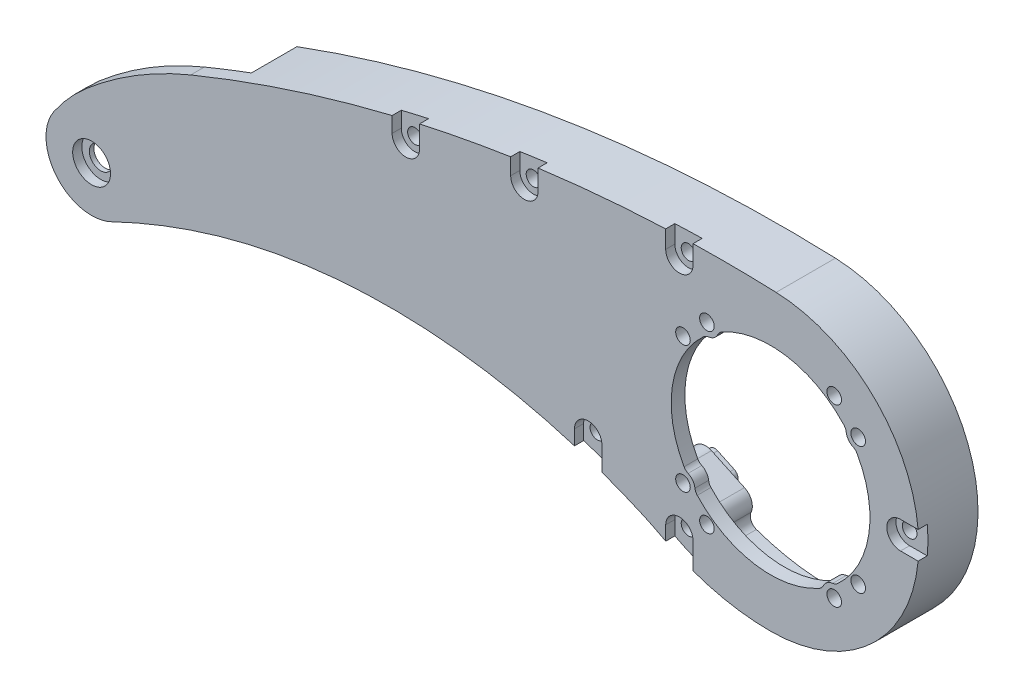
from build123d import *

# Parameters (mm, degrees)
SKETCH_1_R          = 1.6
EXTRUDE_1_DEPTH     = 3
EXTRUDE_START       = 10
SKETCH_2_R          = 1.6
EXTRUDE_2_DEPTH     = 10
EXTRUDE_3_DEPTH     = 2
CUT_EXTRUDE_1_REACH = 164.764
SKETCH_5_R          = 1.6
CUT_EXTRUDE_4_REACH = 164.687
SKETCH_10_R         = 2.5
SKETCH_11_R         = 4.15
CUT_EXTRUDE_5_DEPTH = 2
CUT_EXTRUDE_START   = -2
SKETCH_13_R         = 1.6
CUT_EXTRUDE_6_DEPTH = 2
EXTRUDE_START_2     = 1.5
SKETCH_14_R         = 10
SKETCH_14_R_2       = 7
EXTRUDE_4_DEPTH     = 1.5


with BuildPart() as part:
    # 草图1 → 凸台-拉伸1 (new body)
    with BuildSketch(Plane.XY):
        with BuildLine():
            ThreePointArc((-23.6380873, -26.566491362), (-12.185705724, -30.993964901), (0, -32.5))
            ThreePointArc((0, -32.5), (32.494299771, -0.608672659), (1.217131806, 32.477201083))
            ThreePointArc((1.217131806, 32.477201083), (-64.206902417, 27.922113621), (-127.172269011, 9.580475598))
            ThreePointArc((-127.172269011, 9.580475598), (-139.222290641, 3.45440527), (-150.14384136, -4.511239012))
            ThreePointArc((-150.14384136, -4.511239012), (-153.910924638, -8.201852374), (-157.1671235, -12.350190882))
            ThreePointArc((-157.1671235, -12.350190882), (-156.816374649, -24.130693578), (-145.491863518, -27.395462511))
            ThreePointArc((-145.491863518, -27.395462511), (-145.026167645, -27.212412967), (-144.570211335, -27.006297405))
            ThreePointArc((-144.570211335, -27.006297405), (-136.08176084, -23.223756861), (-127.379272112, -19.963680984))
            ThreePointArc((-127.379272112, -19.963680984), (-77.471346593, -12.811545944), (-28.370763381, -24.26086005))
            ThreePointArc((-28.370763381, -24.26086005), (-25.98221149, -25.368078233), (-23.6380873, -26.566491362))
        make_face()
        with BuildLine():
            ThreePointArc((18.083792076, 11.563072091), (18.591300533, 11.22000242), (18.971162667, 10.73941279))
            ThreePointArc((18.971162667, 10.73941279), (21.531605825, -3.410271338), (14.723986814, -16.076200182))
            ThreePointArc((14.723986814, -16.076200182), (14.214206094, -16.415884227), (13.62552251, -16.585334135))
            ThreePointArc((13.62552251, -16.585334135), (12.402268823, -17.070258581), (11.563072091, -18.083792076))
            ThreePointArc((11.563072091, -18.083792076), (11.22000242, -18.591300533), (10.73941279, -18.971162667))
            ThreePointArc((10.73941279, -18.971162667), (-3.410271338, -21.531605825), (-16.076200182, -14.723986814))
            ThreePointArc((-16.076200182, -14.723986814), (-16.415884227, -14.214206094), (-16.585334135, -13.62552251))
            ThreePointArc((-16.585334135, -13.62552251), (-17.070258581, -12.402268823), (-18.083792076, -11.563072091))
            ThreePointArc((-18.083792076, -11.563072091), (-18.591300533, -11.22000242), (-18.971162667, -10.73941279))
            ThreePointArc((-18.971162667, -10.73941279), (-21.531605825, 3.410271338), (-14.723986814, 16.076200182))
            ThreePointArc((-14.723986814, 16.076200182), (-14.214206094, 16.415884227), (-13.62552251, 16.585334135))
            ThreePointArc((-13.62552251, 16.585334135), (-12.402268823, 17.070258581), (-11.563072091, 18.083792076))
            ThreePointArc((-11.563072091, 18.083792076), (-11.22000242, 18.591300533), (-10.73941279, 18.971162667))
            ThreePointArc((-10.73941279, 18.971162667), (3.410271338, 21.531605825), (16.076200182, 14.723986814))
            ThreePointArc((16.076200182, 14.723986814), (16.415884227, 14.214206094), (16.585334135, 13.62552251))
            ThreePointArc((16.585334135, 13.62552251), (17.070258581, 12.402268823), (18.083792076, 11.563072091))
        make_face(mode=Mode.SUBTRACT)
        with Locations((-13.959899742, -19.214153616)):
            Circle(SKETCH_1_R, mode=Mode.SUBTRACT)
        with Locations((13.959899742, -19.214153616)):
            Circle(SKETCH_1_R, mode=Mode.SUBTRACT)
        with Locations((-19.214153616, -13.959899742)):
            Circle(SKETCH_1_R, mode=Mode.SUBTRACT)
        with Locations((19.214153616, -13.959899742)):
            Circle(SKETCH_1_R, mode=Mode.SUBTRACT)
        with Locations((-19.214153616, 13.959899742)):
            Circle(SKETCH_1_R, mode=Mode.SUBTRACT)
        with Locations((19.214153616, 13.959899742)):
            Circle(SKETCH_1_R, mode=Mode.SUBTRACT)
        with Locations((-13.959899742, 19.214153616)):
            Circle(SKETCH_1_R, mode=Mode.SUBTRACT)
        with Locations((13.959899742, 19.214153616)):
            Circle(SKETCH_1_R, mode=Mode.SUBTRACT)
    extrude(amount=EXTRUDE_1_DEPTH)

    # 草图2 → 凸台-拉伸2 (add)
    with BuildSketch(Plane(origin=(0, 0, 0), x_dir=(-1, 0, 0), z_dir=(0, 0, -1)).offset(EXTRUDE_START)):
        with BuildLine():
            ThreePointArc((17.001102074, 28.618241459), (17.803337861, 26.493729725), (19.86429336, 25.540002931))
            Line((19.86429336, 25.540002931), (27.856104149, 25.178118556))
            ThreePointArc((27.856104149, 25.178118556), (29.994821549, 25.941676183), (30.985784325, 27.98498848))
            ThreePointArc((30.985784325, 27.98498848), (31.663067744, 29.355553639), (33.113908291, 29.837449265))
            ThreePointArc((33.113908291, 29.837449265), (41.227314196, 29.119699609), (49.318671562, 28.185646114))
            ThreePointArc((49.318671562, 28.185646114), (50.642440563, 27.420925697), (51.029255455, 25.941893607))
            ThreePointArc((51.029255455, 25.941893607), (51.587558118, 23.740659748), (53.528225459, 22.561277437))
            Line((53.528225459, 22.561277437), (61.428685658, 21.303211995))
            ThreePointArc((61.428685658, 21.303211995), (63.63968675, 21.821484643), (64.854085448, 23.740434399))
            ThreePointArc((64.854085448, 23.740434399), (65.681160173, 25.026167296), (67.176979656, 25.341897814))
            ThreePointArc((67.176979656, 25.341897814), (71.378861197, 24.513870134), (75.568707204, 23.626949189))
            ThreePointArc((75.568707204, 23.626949189), (76.820720374, 22.749666619), (77.077039123, 21.242529471))
            ThreePointArc((77.077039123, 21.242529471), (77.441191522, 19.000984157), (79.271578812, 17.656806068))
            Line((79.271578812, 17.656806068), (87.032175615, 15.714349565))
            ThreePointArc((87.032175615, 15.714349565), (89.279958958, 16.037772516), (90.657125441, 17.843470399))
            ThreePointArc((90.657125441, 17.843470399), (91.593206584, 19.052153062), (93.11086617, 19.236193992))
            ThreePointArc((93.11086617, 19.236193992), (103.776807204, 16.016684998), (114.31810295, 12.409938501))
            ThreePointArc((114.31810295, 12.409938501), (115.844352177, 12.477074745), (116.877933734, 13.602087253))
            ThreePointArc((116.877933734, 13.602087253), (58.758007498, 28.843357745), (-1.217131806, 32.477201083))
            ThreePointArc((-1.217131806, 32.477201083), (-32.494299771, -0.608672659), (0, -32.5))
            ThreePointArc((0, -32.5), (12.185705724, -30.993964901), (23.6380873, -26.566491362))
            ThreePointArc((23.6380873, -26.566491362), (25.98221149, -25.368078233), (28.370763381, -24.26086005))
            ThreePointArc((28.370763381, -24.26086005), (42.41745626, -18.97671256), (56.959270146, -15.266261857))
            ThreePointArc((56.959270146, -15.266261857), (56.095337342, -13.994443781), (54.584087249, -13.71155818))
            ThreePointArc((54.584087249, -13.71155818), (53.795279647, -13.881664917), (53.007476337, -14.056363738))
            ThreePointArc((53.007476337, -14.056363738), (51.49343256, -13.803829953), (50.585765393, -12.565992248))
            ThreePointArc((50.585765393, -12.565992248), (49.16571342, -10.693278587), (46.831558377, -10.418825857))
            Line((46.831558377, -10.418825857), (39.155257944, -12.671471339))
            ThreePointArc((39.155257944, -12.671471339), (37.339549641, -14.163720453), (37.156649606, -16.506827715))
            ThreePointArc((37.156649606, -16.506827715), (37.061812001, -18.038855032), (35.924321082, -19.069493805))
            ThreePointArc((35.924321082, -19.069493805), (34.270222566, -19.684778141), (32.624096936, -20.321085557))
            ThreePointArc((32.624096936, -20.321085557), (31.089233, -20.303922581), (30.002334443, -19.220062167))
            ThreePointArc((30.002334443, -19.220062167), (28.311680005, -17.587490076), (25.963057786, -17.674540277))
            Line((25.963057786, -17.674540277), (18.723451368, -21.078669963))
            ThreePointArc((18.723451368, -21.078669963), (17.187310183, -22.750078076), (17.261694817, -25.018954835))
            ThreePointArc((17.261694817, -25.018954835), (17.275070203, -26.622295223), (16.106540278, -27.720210117))
            ThreePointArc((16.106540278, -27.720210117), (8.172329404, -29.799953184), (0, -30.5))
            ThreePointArc((0, -30.5), (-19.662506126, -23.315999932), (-30.062360099, -5.148252645))
            ThreePointArc((-30.062360099, -5.148252645), (-29.685338806, -3.685938076), (-28.342105263, -2.995841994))
            ThreePointArc((-28.342105263, -2.995841994), (-25.5, 0), (-28.342105263, 2.995841994))
            ThreePointArc((-28.342105263, 2.995841994), (-29.685338806, 3.685938076), (-30.062360099, 5.148252645))
            ThreePointArc((-30.062360099, 5.148252645), (-20.095728615, 22.943663427), (-1.142231387, 30.478604093))
            ThreePointArc((-1.142231387, 30.478604093), (6.952265997, 30.674453283), (15.049110071, 30.655457646))
            ThreePointArc((15.049110071, 30.655457646), (16.450460044, 30.044409415), (17.001102074, 28.618241459))
        make_face()
        with Locations((20, -23.793522369)):
            Circle(SKETCH_2_R, mode=Mode.SUBTRACT)
        with Locations((-28.5, 0)):
            Circle(SKETCH_2_R, mode=Mode.SUBTRACT)
        with Locations((40, -15.550084001)):
            Circle(SKETCH_2_R, mode=Mode.SUBTRACT)
        with Locations((20, 28.536931977)):
            Circle(SKETCH_2_R, mode=Mode.SUBTRACT)
        with Locations((54, 25.523950011)):
            Circle(SKETCH_2_R, mode=Mode.SUBTRACT)
        with Locations((80, 20.567029869)):
            Circle(SKETCH_2_R, mode=Mode.SUBTRACT)
    extrude(amount=-EXTRUDE_2_DEPTH)

    # 草图4 → 凸台-拉伸3 (add)
    with BuildSketch(Plane(origin=(0, 0, -10), x_dir=(-1, 0, 0), z_dir=(0, 0, -1))):
        with BuildLine():
            Line((27.877880734, -21.746818887), (24.258077525, -23.44888373))
            ThreePointArc((24.258077525, -23.44888373), (22.262377006, -22.729731843), (22.981528893, -20.734031323))
            Line((22.981528893, -20.734031323), (26.601332102, -19.031966481))
            ThreePointArc((26.601332102, -19.031966481), (28.597032621, -19.751118368), (27.877880734, -21.746818887))
        make_face()
        with BuildLine():
            Line((27.92395747, 26.67658308), (23.928052075, 26.857525267))
            ThreePointArc((23.928052075, 26.857525267), (22.497440872, 28.42384311), (24.063758715, 29.854454313))
            Line((24.063758715, 29.854454313), (28.05966411, 29.673512126))
            ThreePointArc((28.05966411, 29.673512126), (29.490275313, 28.107194282), (27.92395747, 26.67658308))
        make_face()
        with BuildLine():
            Line((87.396386209, 17.169461466), (83.516087807, 18.140689717))
            ThreePointArc((83.516087807, 18.140689717), (82.425186501, 19.960012212), (84.244508996, 21.050913518))
            Line((84.244508996, 21.050913518), (88.124807397, 20.079685267))
            ThreePointArc((88.124807397, 20.079685267), (89.215708703, 18.260362772), (87.396386209, 17.169461466))
        make_face()
        with BuildLine():
            Line((48.098671461, -14.73674485), (44.260521244, -15.863067591))
            ThreePointArc((44.260521244, -15.863067591), (42.398843885, -14.846132288), (43.415779189, -12.984454929))
            Line((43.415779189, -12.984454929), (47.253929405, -11.858132188))
            ThreePointArc((47.253929405, -11.858132188), (49.115606764, -12.875067491), (48.098671461, -14.73674485))
        make_face()
        with BuildLine():
            Line((61.664572928, 22.784548282), (57.714342829, 23.413581003))
            ThreePointArc((57.714342829, 23.413581003), (56.468893812, 25.130804561), (58.186117369, 26.376253578))
            Line((58.186117369, 26.376253578), (62.136347469, 25.747220857))
            ThreePointArc((62.136347469, 25.747220857), (63.381796485, 24.029997299), (61.664572928, 22.784548282))
        make_face()
    extrude(amount=EXTRUDE_3_DEPTH)

    # 草图5 → 切除-拉伸1 (cut, up to next)
    with BuildSketch(Plane(origin=(0, 0, -10), x_dir=(-1, 0, 0), z_dir=(0, 0, -1)), mode=Mode.PRIVATE) as cut_extrude_1_sk1:
        with Locations((-28.5, 0)):
            Circle(SKETCH_5_R)
    cut_extrude_1_tool1 = extrude(cut_extrude_1_sk1.sketch, amount=-CUT_EXTRUDE_1_REACH, mode=Mode.PRIVATE) & part.part
    # 草图5 → 切除-拉伸1 (cut, up to next)
    with BuildSketch(Plane(origin=(0, 0, -10), x_dir=(-1, 0, 0), z_dir=(0, 0, -1)), mode=Mode.PRIVATE) as cut_extrude_1_sk2:
        with Locations((54, 25.523950011)):
            Circle(SKETCH_5_R)
    cut_extrude_1_tool2 = extrude(cut_extrude_1_sk2.sketch, amount=-CUT_EXTRUDE_1_REACH, mode=Mode.PRIVATE) & part.part
    # 草图5 → 切除-拉伸1 (cut, up to next)
    with BuildSketch(Plane(origin=(0, 0, -10), x_dir=(-1, 0, 0), z_dir=(0, 0, -1)), mode=Mode.PRIVATE) as cut_extrude_1_sk3:
        with Locations((80, 20.567029869)):
            Circle(SKETCH_5_R)
    cut_extrude_1_tool3 = extrude(cut_extrude_1_sk3.sketch, amount=-CUT_EXTRUDE_1_REACH, mode=Mode.PRIVATE) & part.part
    # 草图5 → 切除-拉伸1 (cut, up to next)
    with BuildSketch(Plane(origin=(0, 0, -10), x_dir=(-1, 0, 0), z_dir=(0, 0, -1)), mode=Mode.PRIVATE) as cut_extrude_1_sk4:
        with Locations((40, -15.550084001)):
            Circle(SKETCH_5_R)
    cut_extrude_1_tool4 = extrude(cut_extrude_1_sk4.sketch, amount=-CUT_EXTRUDE_1_REACH, mode=Mode.PRIVATE) & part.part
    # 草图5 → 切除-拉伸1 (cut, up to next)
    with BuildSketch(Plane(origin=(0, 0, -10), x_dir=(-1, 0, 0), z_dir=(0, 0, -1)), mode=Mode.PRIVATE) as cut_extrude_1_sk5:
        with Locations((20, -23.793522369)):
            Circle(SKETCH_5_R)
    cut_extrude_1_tool5 = extrude(cut_extrude_1_sk5.sketch, amount=-CUT_EXTRUDE_1_REACH, mode=Mode.PRIVATE) & part.part
    # 草图5 → 切除-拉伸1 (cut, up to next)
    with BuildSketch(Plane(origin=(0, 0, -10), x_dir=(-1, 0, 0), z_dir=(0, 0, -1)), mode=Mode.PRIVATE) as cut_extrude_1_sk6:
        with Locations((20, 28.536931977)):
            Circle(SKETCH_5_R)
    cut_extrude_1_tool6 = extrude(cut_extrude_1_sk6.sketch, amount=-CUT_EXTRUDE_1_REACH, mode=Mode.PRIVATE) & part.part
    add(cut_extrude_1_tool1.solids().sort_by_distance((28.5, 0, -10))[0], mode=Mode.SUBTRACT)
    add(cut_extrude_1_tool2.solids().sort_by_distance((-54, 25.52395, -10))[0], mode=Mode.SUBTRACT)
    add(cut_extrude_1_tool3.solids().sort_by_distance((-80, 20.56703, -10))[0], mode=Mode.SUBTRACT)
    add(cut_extrude_1_tool4.solids().sort_by_distance((-40, -15.550084, -10))[0], mode=Mode.SUBTRACT)
    add(cut_extrude_1_tool5.solids().sort_by_distance((-20, -23.793522, -10))[0], mode=Mode.SUBTRACT)
    add(cut_extrude_1_tool6.solids().sort_by_distance((-20, 28.536932, -10))[0], mode=Mode.SUBTRACT)

    # 草图10 → 切除-拉伸4 (cut, up to next)
    with BuildSketch(Plane(origin=(0, 0, 0), x_dir=(-1, 0, 0), z_dir=(0, 0, -1)), mode=Mode.PRIVATE) as cut_extrude_4_sk1:
        with Locations((148.916083752, -18)):
            Circle(SKETCH_10_R)
    cut_extrude_4_tool1 = extrude(cut_extrude_4_sk1.sketch, amount=-CUT_EXTRUDE_4_REACH, mode=Mode.PRIVATE) & part.part
    add(cut_extrude_4_tool1.solids().sort_by_distance((-148.916084, -18, 0))[0], mode=Mode.SUBTRACT)

    # 草图11 → 切除-拉伸5 (cut)
    with BuildSketch(Plane.XY.offset(3)):
        with Locations((-148.916083752, -18)):
            Circle(SKETCH_11_R)
    extrude(amount=-CUT_EXTRUDE_5_DEPTH, mode=Mode.SUBTRACT)

    # 草图13 → 切除-拉伸6 (cut)
    # profile 1 of 6: a face of its own
    with BuildSketch(Plane.XY.offset(3).offset(CUT_EXTRUDE_START)):
        with BuildLine():
            ThreePointArc((-43, -18.79486084), (-39.988341619, -19.766013748), (-37, -20.806705127))
            Line((-37, -20.806705127), (-37, -15.550084001))
            ThreePointArc((-37, -15.550084001), (-40, -12.550084001), (-43, -15.550084001))
            Line((-43, -15.550084001), (-43, -18.79486084))
        make_face()
        with Locations((-40, -15.550084001)):
            Circle(SKETCH_13_R, mode=Mode.SUBTRACT)
    # profile 2 of 6: a face of its own
    with BuildSketch(Plane.XY.offset(3).offset(CUT_EXTRUDE_START)):
        with BuildLine():
            ThreePointArc((-23, -26.902477601), (-20.04292434, -28.311736195), (-17, -29.524550153))
            Line((-17, -29.524550153), (-17, -23.793522369))
            ThreePointArc((-17, -23.793522369), (-20, -20.793522369), (-23, -23.793522369))
            Line((-23, -23.793522369), (-23, -26.902477601))
        make_face()
        with Locations((-20, -23.793522369)):
            Circle(SKETCH_13_R, mode=Mode.SUBTRACT)
    # profile 3 of 6: a face of its own
    with BuildSketch(Plane.XY.offset(3).offset(CUT_EXTRUDE_START)):
        with BuildLine():
            ThreePointArc((32.361242251, -3), (32.5, 0), (32.361242251, 3))
            Line((32.361242251, 3), (28.5, 3))
            ThreePointArc((28.5, 3), (25.5, 0), (28.5, -3))
            Line((28.5, -3), (32.361242251, -3))
        make_face()
        with Locations((28.5, 0)):
            Circle(SKETCH_13_R, mode=Mode.SUBTRACT)
    # profile 4 of 6: a face of its own
    with BuildSketch(Plane.XY.offset(3).offset(CUT_EXTRUDE_START)):
        with BuildLine():
            ThreePointArc((-17, 32.619234927), (-20.000463964, 32.53894641), (-23, 32.429338848))
            Line((-23, 32.429338848), (-23, 28.536931977))
            ThreePointArc((-23, 28.536931977), (-20, 25.536931977), (-17, 28.536931977))
            Line((-17, 28.536931977), (-17, 32.619234927))
        make_face()
        with Locations((-20, 28.536931977)):
            Circle(SKETCH_13_R, mode=Mode.SUBTRACT)
    # profile 5 of 6: a face of its own
    with BuildSketch(Plane.XY.offset(3).offset(CUT_EXTRUDE_START)):
        with BuildLine():
            ThreePointArc((-51, 29.981954991), (-54.002128749, 29.565339979), (-57, 29.119119123))
            Line((-57, 29.119119123), (-57, 25.523950011))
            ThreePointArc((-57, 25.523950011), (-54, 22.523950011), (-51, 25.523950011))
            Line((-51, 25.523950011), (-51, 29.981954991))
        make_face()
        with Locations((-54, 25.523950011)):
            Circle(SKETCH_13_R, mode=Mode.SUBTRACT)
    # profile 6 of 6: a face of its own
    with BuildSketch(Plane.XY.offset(3).offset(CUT_EXTRUDE_START)):
        with BuildLine():
            Line((-83, 23.960592486), (-83, 20.567029869))
            ThreePointArc((-83, 20.567029869), (-80, 17.567029869), (-77, 20.567029869))
            Line((-77, 20.567029869), (-77, 25.359108824))
            ThreePointArc((-77, 25.359108824), (-80.003506771, 24.674895616), (-83, 23.960592486))
        make_face()
        with Locations((-80, 20.567029869)):
            Circle(SKETCH_13_R, mode=Mode.SUBTRACT)
    extrude(amount=CUT_EXTRUDE_6_DEPTH, mode=Mode.SUBTRACT)

    # 草图14 → 凸台-拉伸4 (add)
    with BuildSketch(Plane(origin=(0, 0, 0), x_dir=(-1, 0, 0), z_dir=(0, 0, -1)).offset(EXTRUDE_START_2)):
        with Locations((148.916083752, -18)):
            Circle(SKETCH_14_R)
        with Locations((148.916083752, -18)):
            Circle(SKETCH_14_R_2, mode=Mode.SUBTRACT)
    extrude(amount=-EXTRUDE_4_DEPTH)


solid = part.part
